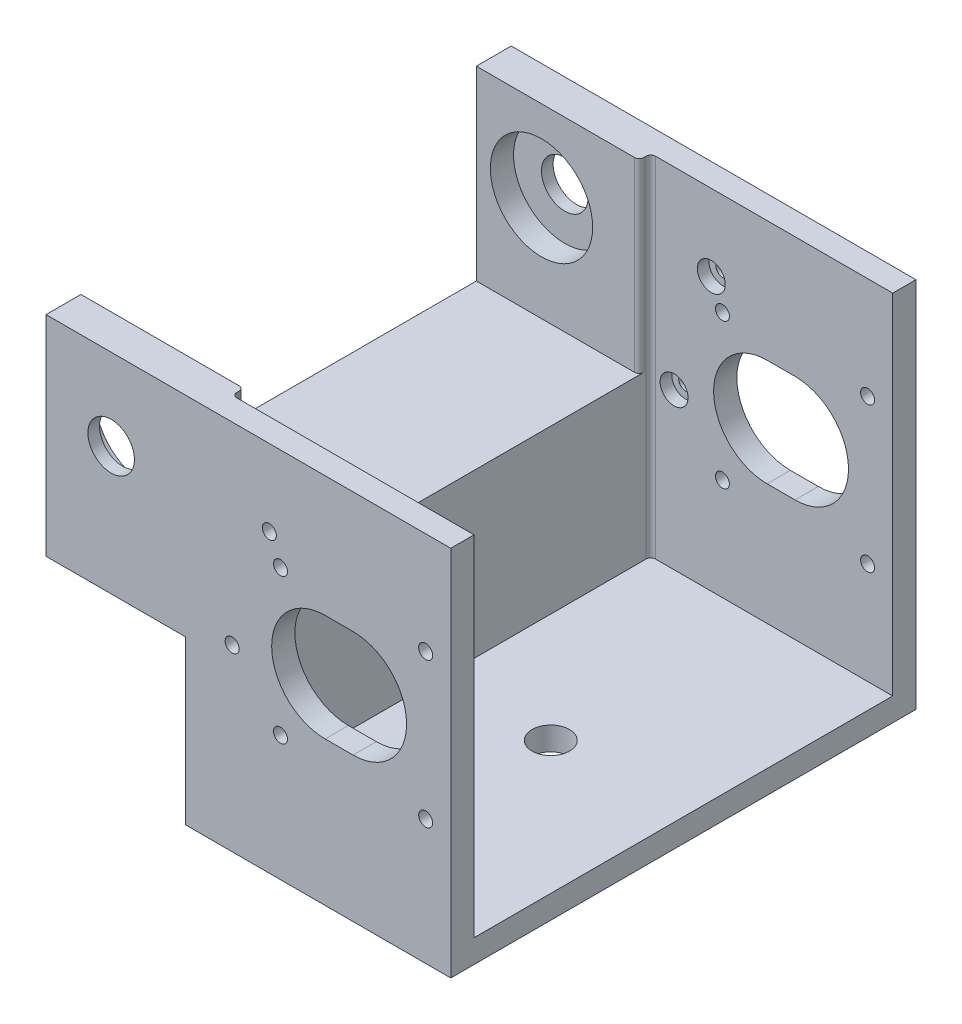
from build123d import *

# Parameters (mm, degrees)
SKETCH1_W           = 57
SKETCH1_H           = 100
BOSS_EXTRUDE1_DEPTH = 80
SKETCH3_W           = 75
SKETCH3_H           = 90
CUT_EXTRUDE1_DEPTH  = 52
SKETCH4_R           = 4.025
CUT_EXTRUDE2_DEPTH  = 114.213294272
BOSS_EXTRUDE2_DEPTH = 30
CUT_EXTRUDE5_REACH  = 112.223
SKETCH8_W           = 85
SKETCH8_H           = 40
SKETCH5_R           = 5
SKETCH5_R_2         = 1.5
CUT_EXTRUDE3_DEPTH  = 141.791512528
SKETCH9_R           = 11
SKETCH9_R_2         = 3
CUT_EXTRUDE6_DEPTH  = 47.5
FILLET1_R           = 1


with BuildPart() as part:
    # Sketch1 → Boss-Extrude1 (new body)
    with BuildSketch(Plane(origin=(0, 0, 0), x_dir=(1, 0, 0), z_dir=(0, 1, 0))):
        Rectangle(SKETCH1_W, SKETCH1_H)
    extrude(amount=BOSS_EXTRUDE1_DEPTH)

    # Sketch3 → Cut-Extrude1 (cut)
    with BuildSketch(Plane(origin=(28.5, 40, 0), x_dir=(0, 1, 0), z_dir=(-1, 0, 0))):
        with Locations((2.5, 0)):
            Rectangle(SKETCH3_W, SKETCH3_H)
    extrude(amount=CUT_EXTRUDE1_DEPTH, mode=Mode.SUBTRACT)

    # Sketch4 → Cut-Extrude2 (cut, through all)
    with BuildSketch(Plane(origin=(-40, 5, 0), x_dir=(-1, 0, 0), z_dir=(0, -1, 0))):
        with Locations((-40, 0)):
            Circle(SKETCH4_R)
    extrude(amount=CUT_EXTRUDE2_DEPTH, mode=Mode.SUBTRACT)

    # Sketch7 → Boss-Extrude2 (add)
    with BuildSketch(Plane.ZY.offset(28.5)):
        Polygon((-50, 80), (-42.5, 80), (-42.5, 40), (42.5, 40), (42.5, 80), (50, 80), (50, 35), (-50, 35), align=None)
    extrude(amount=BOSS_EXTRUDE2_DEPTH)

    # Sketch8 → Cut-Extrude5 (cut, up to next)
    with BuildSketch(Plane.ZY.offset(28.5), mode=Mode.PRIVATE) as cut_extrude5_sk1:
        with Locations((0, 60)):
            Rectangle(SKETCH8_W, SKETCH8_H)
    cut_extrude5_tool1 = extrude(cut_extrude5_sk1.sketch, amount=-CUT_EXTRUDE5_REACH, mode=Mode.PRIVATE) & part.part
    add(cut_extrude5_tool1.solids().sort_by_distance((-28.5, 60, 0))[0], mode=Mode.SUBTRACT)

    # Sketch5 → Cut-Extrude3 (cut, through all)
    with BuildSketch(Plane(origin=(0, 0, -50), x_dir=(-1, 0, 0), z_dir=(0, 0, -1))):
        with Locations((44.5, 62.5)):
            Circle(SKETCH5_R)
        with Locations((-23.1, 58.1)):
            Circle(SKETCH5_R_2)
        with Locations((8.1, 58.1)):
            Circle(SKETCH5_R_2)
        with Locations((8.1, 26.9)):
            Circle(SKETCH5_R_2)
        with Locations((-23.1, 26.9)):
            Circle(SKETCH5_R_2)
        with Locations((10.5, 63.6)):
            Circle(SKETCH5_R_2)
        with Locations((18.5, 38.5)):
            Circle(SKETCH5_R_2)
        with BuildLine():
            Line((-1.5, 31), (-7.5, 31))
            ThreePointArc((-7.5, 31), (-19, 42.5), (-7.5, 54))
            Line((-7.5, 54), (-1.5, 54))
            ThreePointArc((-1.5, 54), (10, 42.5), (-1.5, 31))
        make_face()
    extrude(amount=-CUT_EXTRUDE3_DEPTH, mode=Mode.SUBTRACT)

    # Sketch9 → Cut-Extrude6 (cut, symmetric)
    with BuildSketch(Plane.XY):
        with Locations((-44.5, 62.5)):
            Circle(SKETCH9_R)
        with Locations((-10.5, 63.6)):
            Circle(SKETCH9_R_2)
        with Locations((-18.5, 38.5)):
            Circle(SKETCH9_R_2)
    extrude(amount=CUT_EXTRUDE6_DEPTH, both=True, mode=Mode.SUBTRACT)

    # Fillet1
    fillet1_edges = [part.edges().sort_by_distance(p)[0] for p in [
        (-23.5, 42.5, 45),
        (-23.5, 60, 42.5),
        (-23.5, 42.5, -45),
        (-23.5, 60, -42.5),
    ]]
    fillet(fillet1_edges, radius=FILLET1_R)


solid = part.part
